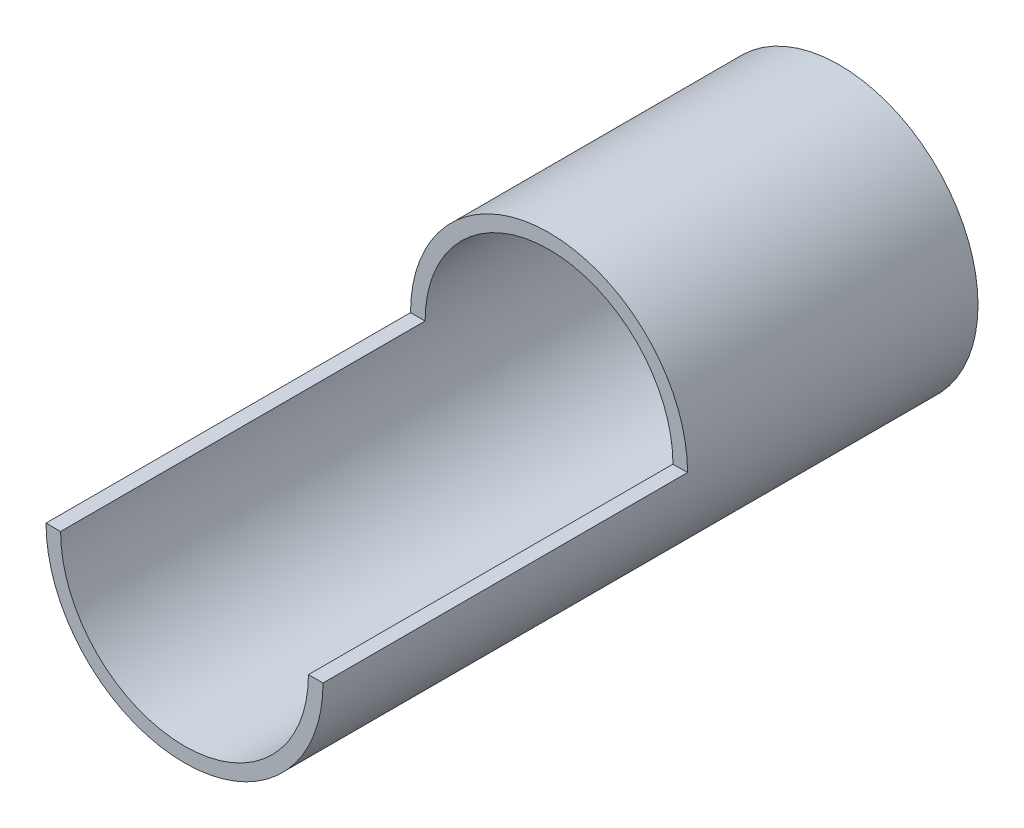
from build123d import *

# Parameters (mm, degrees)
SKETCH1_R           = 24.13
SKETCH1_R_2         = 21.59
BOSS_EXTRUDE1_DEPTH = 114.099999892
SKETCH3_W           = 48.26
SKETCH3_H           = 24.13
CUT_EXTRUDE1_DEPTH  = 63.5


with BuildPart() as part:
    # Sketch1 → Boss-Extrude1 (new body)
    with BuildSketch(Plane.XY):
        Circle(SKETCH1_R)
        Circle(SKETCH1_R_2, mode=Mode.SUBTRACT)
    extrude(amount=BOSS_EXTRUDE1_DEPTH)

    # Sketch3 → Cut-Extrude1 (cut)
    with BuildSketch(Plane.XY.offset(114.099999892)):
        with Locations((0, 12.065)):
            Rectangle(SKETCH3_W, SKETCH3_H)
    extrude(amount=-CUT_EXTRUDE1_DEPTH, mode=Mode.SUBTRACT)


solid = part.part
